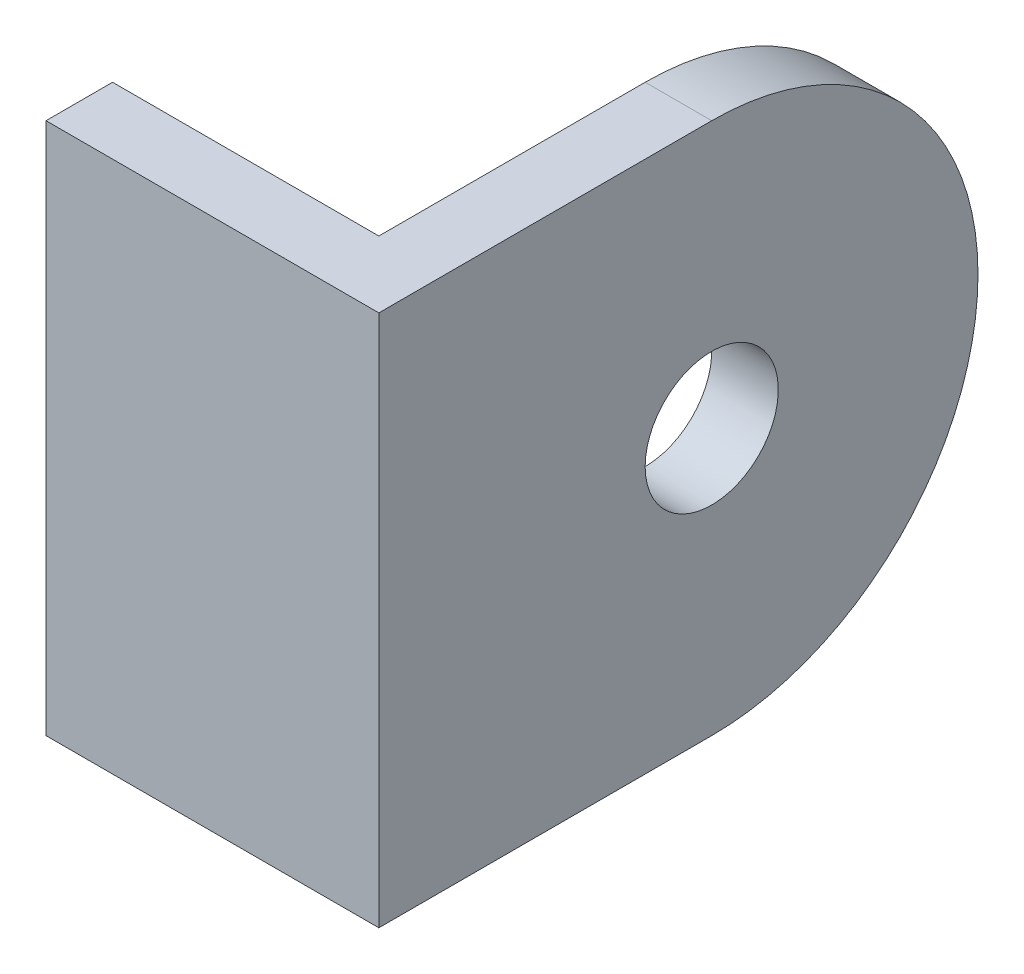
from build123d import *

# Parameters (mm, degrees)
BOSS_EXTRUDE1_DEPTH = 20
FILLET1_R           = 20
FILLET2_R           = 20
SKETCH2_R           = 5
CUT_EXTRUDE2_DEPTH  = 40


with BuildPart() as part:
    # Sketch1 → Boss-Extrude1 (new, symmetric)
    with BuildSketch(Plane(origin=(0, 0, 0), x_dir=(1, 0, 0), z_dir=(0, 1, 0))):
        Polygon((-4.418120101, 15.201487277), (0.581879899, 15.201487277), (0.581879899, -29.798512723), (-24.418120101, -29.798512723), (-24.418120101, -24.798512723), (-4.418120101, -24.798512723), align=None)
    extrude(amount=BOSS_EXTRUDE1_DEPTH, both=True)

    # Fillet1
    fillet1_edges = [part.edges().sort_by_distance(p)[0] for p in [
        (-1.918120101, -20, -15.201487277),
    ]]
    fillet(fillet1_edges, radius=FILLET1_R)

    # Fillet2
    fillet2_edges = [part.edges().sort_by_distance(p)[0] for p in [
        (-1.918120101, 20, -15.201487277),
    ]]
    fillet(fillet2_edges, radius=FILLET2_R - 0.0001)  # a hair under: the kernel refuses the full size

    # Sketch2 → Cut-Extrude2 (cut)
    with BuildSketch(Plane.ZY.offset(4.418120101)):
        with Locations((4.798512723, 0)):
            Circle(SKETCH2_R)
    extrude(amount=-CUT_EXTRUDE2_DEPTH, mode=Mode.SUBTRACT)


solid = part.part
